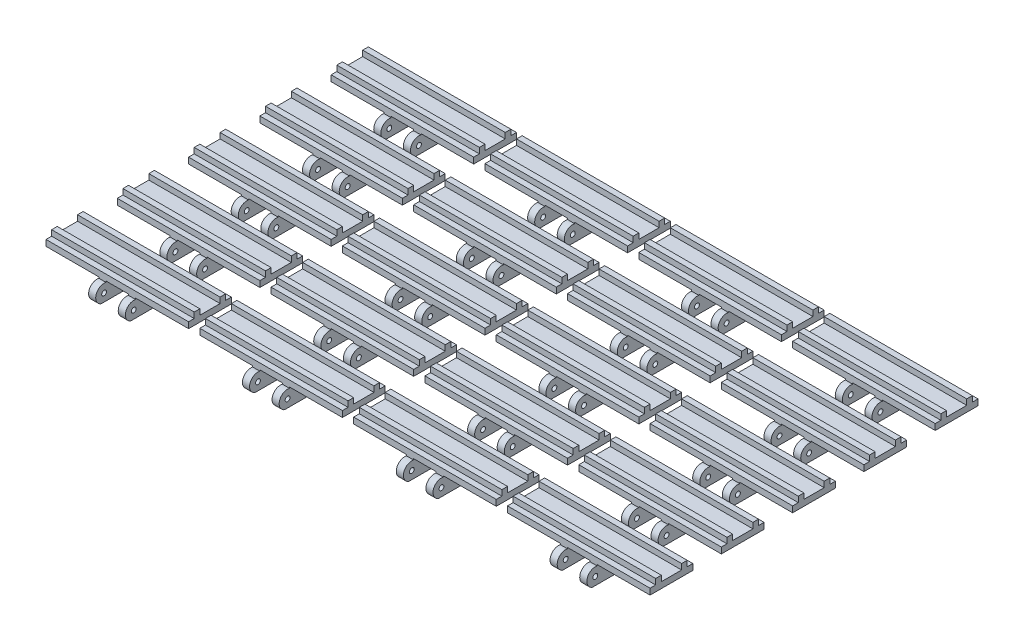
from build123d import *

# Parameters (mm, degrees)
SKETCH_1_W                = 38
SKETCH_1_H                = 11.4
EXTRUDE_1_DEPTH           = 1.6
SKETCH_1_4_W              = 4
SKETCH_1_4_H              = 14
EXTRUDE_2_DEPTH           = 5
SKETCH_2_W                = 0.1
SKETCH_2_H                = 1.3
SKETCH_2_W_2              = 10
SKETCH_2_W_3              = 2
CUT_EXTRUDE_1_DEPTH       = 21.856653615
CUT_EXTRUDE_START         = 7
CUT_EXTRUDE_2_DEPTH       = 2.1
CUT_EXTRUDE_START_2       = -4.9
CUT_EXTRUDE_3_DEPTH       = 2.1
CUT_EXTRUDE_6_DEPTH       = 21.856653615
CUT_EXTRUDE_6_DEPTH_BACK  = 21.856653615
EXTRUDE_START             = 5.1
SKETCH_4_6_R              = 2.25
EXTRUDE_3_DEPTH           = 1.9
EXTRUDE_START_2           = -7
SKETCH_4_7_R              = 2.25
EXTRUDE_4_DEPTH           = 1.9
CUT_EXTRUDE_7_DEPTH       = 22.386970332
CUT_EXTRUDE_7_DEPTH_BACK  = 22.386970332
SKETCH_3_R                = 0.65
SKETCH_3_R_2              = 0.55
CUT_EXTRUDE_START_3       = 3
CUT_EXTRUDE_8_DEPTH       = 2.1
CUT_EXTRUDE_START_4       = -5.1
SKETCH_5_2_R              = 2.5
SKETCH_5_2_W              = 2.5
SKETCH_5_2_H              = 2.5
CUT_EXTRUDE_9_DEPTH       = 5.1
CUT_EXTRUDE_10_DEPTH      = 22.386970332
CUT_EXTRUDE_10_DEPTH_BACK = 22.386970332
EXTRUDE_START_3           = 3
EXTRUDE_5_DEPTH           = 1.9
EXTRUDE_START_4           = -4.9
EXTRUDE_6_DEPTH           = 1.9
CUT_EXTRUDE_11_DEPTH      = 22.386970332
CUT_EXTRUDE_11_DEPTH_BACK = 22.386970332
SKETCH_3_3_R              = 0.65
SKETCH_3_3_R_2            = 0.55
CUT_EXTRUDE_12_DEPTH      = 22.386970332
CUT_EXTRUDE_12_DEPTH_BACK = 22.386970332
SKETCH_9_W                = 15.45
SKETCH_9_H                = 0.397025916
SKETCH_10_W               = 38
SKETCH_10_H               = 1.5
EXTRUDE_7_DEPTH           = 1.5
FILLET_1_R                = 1
SKETCH_11_W               = 4.7
SKETCH_11_H               = 4.602974084
CUT_EXTRUDE_13_DEPTH      = 17.397649411
CUT_EXTRUDE_START_5       = 4.9
SKETCH_11_2_W             = 4.7
SKETCH_11_2_H             = 4.602974084
CUT_EXTRUDE_14_DEPTH      = 17.397649411
CUT_EXTRUDE_START_6       = 5.1
SKETCH_11_4_W             = 4.7
SKETCH_11_4_H             = 4.602974084
CUT_EXTRUDE_15_DEPTH      = 10.2
PATTERN_LINEAR_1_COUNT    = 5
PATTERN_LINEAR_1_PITCH    = 19
PATTERN_LINEAR_2_COUNT    = 4
PATTERN_LINEAR_2_PITCH    = 41


# Read off the part's stored shape, not the designer's step: 切除-拉伸8, 凸台-拉伸5, 凸台-拉伸6
with BuildPart() as part:
    # 草图1 → 凸台-拉伸1 (new body)
    with BuildSketch(Plane(origin=(0, 0, 0), x_dir=(1, 0, 0), z_dir=(0, 1, 0))):
        Rectangle(SKETCH_1_W, SKETCH_1_H)
    extrude(amount=EXTRUDE_1_DEPTH)

    # 草图1<4> → 凸台-拉伸2 (add)
    with BuildSketch(Plane(origin=(0, 0, 0), x_dir=(1, 0, 0), z_dir=(0, 1, 0))):
        with Locations((-5, 0)):
            Rectangle(SKETCH_1_4_W, SKETCH_1_4_H)
        with Locations((5, 0)):
            Rectangle(SKETCH_1_4_W, SKETCH_1_4_H)
    extrude(amount=-EXTRUDE_2_DEPTH)

    # 草图2 → 切除-拉伸1 (cut, through all)
    with BuildSketch(Plane(origin=(0, 0, 0), x_dir=(1, 0, 0), z_dir=(0, 1, 0))):
        with Locations((-5.05, 6.35)):
            Rectangle(SKETCH_2_W, SKETCH_2_H)
        with Locations((0, 6.35)):
            Rectangle(SKETCH_2_W_2, SKETCH_2_H)
        with Locations((5.05, 6.35)):
            Rectangle(SKETCH_2_W, SKETCH_2_H)
        with Locations((-6, -6.35)):
            Rectangle(SKETCH_2_W_3, SKETCH_2_H)
        with Locations((-4.95, -6.35)):
            Rectangle(SKETCH_2_W, SKETCH_2_H)
        with Locations((4.95, -6.35)):
            Rectangle(SKETCH_2_W, SKETCH_2_H)
        with Locations((6, -6.35)):
            Rectangle(SKETCH_2_W_3, SKETCH_2_H)
    extrude(amount=-CUT_EXTRUDE_1_DEPTH, mode=Mode.SUBTRACT)

    # 草图4 → 切除-拉伸2 (cut)
    with BuildSketch(Plane(origin=(0, 0, 0), x_dir=(0, 0, -1), z_dir=(1, 0, 0)).offset(CUT_EXTRUDE_START)):
        with BuildLine():
            ThreePointArc((-3.7, -2.5), (-4.263508327, -0.91886117), (-5.7, -0.050510257))
            Line((-5.7, -0.050510257), (-5.7, -5))
            Line((-5.7, -5), (-3.7, -5))
            Line((-3.7, -5), (-3.7, -2.5))
        make_face()
    extrude(amount=-CUT_EXTRUDE_2_DEPTH, mode=Mode.SUBTRACT)

    # 草图4<3> → 切除-拉伸3 (cut)
    with BuildSketch(Plane(origin=(0, 0, 0), x_dir=(0, 0, -1), z_dir=(1, 0, 0)).offset(CUT_EXTRUDE_START_2)):
        with BuildLine():
            ThreePointArc((-3.7, -2.5), (-4.263508327, -0.91886117), (-5.7, -0.050510257))
            Line((-5.7, -0.050510257), (-5.7, -5))
            Line((-5.7, -5), (-3.7, -5))
            Line((-3.7, -5), (-3.7, -2.5))
        make_face()
    extrude(amount=-CUT_EXTRUDE_3_DEPTH, mode=Mode.SUBTRACT)

    # 草图4<5> → 切除-拉伸6 (cut, two sides: drawn at the far end of the back side and taken through both)
    with BuildSketch(Plane(origin=(0, 0, 0), x_dir=(0, 0, -1), z_dir=(1, 0, 0)).offset(-CUT_EXTRUDE_6_DEPTH_BACK)):
        with BuildLine():
            Line((8.45, 0), (5.7, 0))
            Line((5.7, 0), (5.7, -0.306258903))
            ThreePointArc((5.7, -0.306258903), (7.60312152, -0.74109409), (8.45, -2.5))
            Line((8.45, -2.5), (8.45, 0))
        make_face()
        with BuildLine():
            Line((8.45, -5), (8.45, -2.5))
            ThreePointArc((8.45, -2.5), (7.60312152, -4.25890591), (5.7, -4.693741097))
            Line((5.7, -4.693741097), (5.7, -5))
            Line((5.7, -5), (8.45, -5))
        make_face()
    extrude(amount=CUT_EXTRUDE_6_DEPTH + CUT_EXTRUDE_6_DEPTH_BACK, mode=Mode.SUBTRACT)

    # 草图4<6> → 凸台-拉伸3 (add)
    with BuildSketch(Plane(origin=(0, 0, 0), x_dir=(0, 0, -1), z_dir=(1, 0, 0)).offset(EXTRUDE_START)):
        with Locations((6.2, -2.5)):
            Circle(SKETCH_4_6_R)
    extrude(amount=EXTRUDE_3_DEPTH)

    # 草图4<7> → 凸台-拉伸4 (add)
    with BuildSketch(Plane(origin=(0, 0, 0), x_dir=(0, 0, -1), z_dir=(1, 0, 0)).offset(EXTRUDE_START_2)):
        with Locations((6.2, -2.5)):
            Circle(SKETCH_4_7_R)
    extrude(amount=EXTRUDE_4_DEPTH)

    # 草图3 → 切除-拉伸7 (cut, two sides: drawn at the far end of the back side and taken through both)
    with BuildSketch(Plane(origin=(0, 0, 0), x_dir=(0, 0, -1), z_dir=(1, 0, 0)).offset(-CUT_EXTRUDE_7_DEPTH_BACK)):
        with Locations(Location((-6.2, -2.5, 0), (0, 0, 180))):
            Circle(SKETCH_3_R)
        with Locations(Location((6.2, -2.5, 0), (0, 0, 204.619977329))):
            Circle(SKETCH_3_R_2)
    extrude(amount=CUT_EXTRUDE_7_DEPTH + CUT_EXTRUDE_7_DEPTH_BACK, mode=Mode.SUBTRACT)

    # 切除-拉伸8 outline → 切除-拉伸8 (cut)
    with BuildSketch(Plane(origin=(0, 0, 0), x_dir=(0, 0, -1), z_dir=(1, 0, 0)).offset(CUT_EXTRUDE_START_3)):
        with BuildLine():
            Line((3.7, -2.5), (3.7, -5))
            Line((3.7, -5), (5.7, -5))
            Line((5.7, -5), (5.7, -2.729128785))
            ThreePointArc((5.7, -2.729128785), (5.65, -2.5), (5.7, -2.270871215))
            Line((5.7, -2.270871215), (5.7, -0.050510257))
            ThreePointArc((5.7, -0.050510257), (4.263508327, -0.91886117), (3.7, -2.5))
        make_face()
    extrude(amount=CUT_EXTRUDE_8_DEPTH, mode=Mode.SUBTRACT)

    # 草图5<2> → 切除-拉伸9 (cut)
    with BuildSketch(Plane(origin=(0, 0, 0), x_dir=(0, 0, -1), z_dir=(1, 0, 0)).offset(CUT_EXTRUDE_START_4)):
        with Locations((6.2, -2.5)):
            Circle(SKETCH_5_2_R)
        with Locations((4.95, -3.75)):
            Rectangle(SKETCH_5_2_W, SKETCH_5_2_H)
    extrude(amount=CUT_EXTRUDE_9_DEPTH, mode=Mode.SUBTRACT)

    # 草图7 → 切除-拉伸10 (cut, two sides: drawn at the far end of the back side and taken through both)
    with BuildSketch(Plane(origin=(0, 0, 0), x_dir=(0, 0, -1), z_dir=(1, 0, 0)).offset(-CUT_EXTRUDE_10_DEPTH_BACK)):
        with BuildLine():
            Line((-5.7, -0.306258903), (-5.7, 0))
            Line((-5.7, 0), (-8.45, 0))
            Line((-8.45, 0), (-8.45, -2.5))
            ThreePointArc((-8.45, -2.5), (-7.60312152, -0.74109409), (-5.7, -0.306258903))
        make_face()
    extrude(amount=CUT_EXTRUDE_10_DEPTH + CUT_EXTRUDE_10_DEPTH_BACK, mode=Mode.SUBTRACT)

    # 凸台-拉伸5 outline → 凸台-拉伸5 (add)
    with BuildSketch(Plane(origin=(0, 0, 0), x_dir=(0, 0, -1), z_dir=(1, 0, 0)).offset(EXTRUDE_START_3)):
        with BuildLine():
            Line((-7, -4.602974084), (-7, -0.397025915))
            ThreePointArc((-7, -0.397025915), (-8.45, -2.5), (-7, -4.602974084))
        make_face()
        with BuildLine():
            ThreePointArc((-5.7, -2.084668807), (-6.85, -2.5), (-5.7, -2.915331193))
            Line((-5.7, -2.915331193), (-5.7, -2.084668807))
        make_face()
    extrude(amount=EXTRUDE_5_DEPTH)

    # 凸台-拉伸6 outline → 凸台-拉伸6 (add)
    with BuildSketch(Plane(origin=(0, 0, 0), x_dir=(0, 0, -1), z_dir=(1, 0, 0)).offset(EXTRUDE_START_4)):
        with BuildLine():
            Line((-7, -4.602974084), (-7, -0.397025915))
            ThreePointArc((-7, -0.397025915), (-8.45, -2.5), (-7, -4.602974084))
        make_face()
        with BuildLine():
            ThreePointArc((-5.7, -2.084668807), (-6.85, -2.5), (-5.7, -2.915331193))
            Line((-5.7, -2.915331193), (-5.7, -2.084668807))
        make_face()
    extrude(amount=EXTRUDE_6_DEPTH)

    # 草图3<3> → 切除-拉伸11 (cut, two sides: drawn at the far end of the back side and taken through both)
    with BuildSketch(Plane(origin=(0, 0, 0), x_dir=(0, 0, -1), z_dir=(1, 0, 0)).offset(-CUT_EXTRUDE_11_DEPTH_BACK)):
        with Locations(Location((-6.2, -2.5, 0), (0, 0, 180))):
            Circle(SKETCH_3_3_R)
        with Locations(Location((6.2, -2.5, 0), (0, 0, 180))):
            Circle(SKETCH_3_3_R_2)
    extrude(amount=CUT_EXTRUDE_11_DEPTH + CUT_EXTRUDE_11_DEPTH_BACK, mode=Mode.SUBTRACT)

    # 草图9 → 切除-拉伸12 (cut, two sides: drawn at the far end of the back side and taken through both)
    with BuildSketch(Plane(origin=(0, 0, 0), x_dir=(0, 0, -1), z_dir=(1, 0, 0)).offset(-CUT_EXTRUDE_12_DEPTH_BACK)):
        with Locations((0.725, -4.801487042)):
            Rectangle(SKETCH_9_W, SKETCH_9_H)
    extrude(amount=CUT_EXTRUDE_12_DEPTH + CUT_EXTRUDE_12_DEPTH_BACK, mode=Mode.SUBTRACT)

    # 草图10 → 凸台-拉伸7 (add)
    with BuildSketch(Plane(origin=(0, 1.6, 0), x_dir=(1, 0, 0), z_dir=(0, 1, 0))):
        with Locations((0, 3.45)):
            Rectangle(SKETCH_10_W, SKETCH_10_H)
        with Locations((0, -3.45)):
            Rectangle(SKETCH_10_W, SKETCH_10_H)
    extrude(amount=EXTRUDE_7_DEPTH)

    # 圆角1
    fillet_1_edges = [part.edges().sort_by_distance(p)[0] for p in [
        (5.95, -4.602974084, 3.7),
        (4.05, -4.602974084, -3.7),
        (-4.05, -4.602974084, -3.7),
        (-5.95, -4.602974084, 3.7),
    ]]
    fillet(fillet_1_edges, radius=FILLET_1_R)

    # 草图11 → 切除-拉伸13 (cut, through all)
    with BuildSketch(Plane(origin=(0, 0, 0), x_dir=(0, 0, -1), z_dir=(1, 0, 0)).offset(CUT_EXTRUDE_START_2)):
        with Locations((-3.35, -2.301487042)):
            Rectangle(SKETCH_11_W, SKETCH_11_H)
    extrude(amount=-CUT_EXTRUDE_13_DEPTH, mode=Mode.SUBTRACT)

    # 草图11<2> → 切除-拉伸14 (cut, through all)
    with BuildSketch(Plane(origin=(0, 0, 0), x_dir=(0, 0, -1), z_dir=(1, 0, 0)).offset(CUT_EXTRUDE_START_5)):
        with Locations((-3.35, -2.301487042)):
            Rectangle(SKETCH_11_2_W, SKETCH_11_2_H)
    extrude(amount=CUT_EXTRUDE_14_DEPTH, mode=Mode.SUBTRACT)

    # 草图11<4> → 切除-拉伸15 (cut)
    with BuildSketch(Plane(origin=(0, 0, 0), x_dir=(0, 0, -1), z_dir=(1, 0, 0)).offset(CUT_EXTRUDE_START_6)):
        with Locations((3.35, -2.301487042)):
            Rectangle(SKETCH_11_4_W, SKETCH_11_4_H)
    extrude(amount=-CUT_EXTRUDE_15_DEPTH, mode=Mode.SUBTRACT)


with BuildPart() as pattern_linear_1_1:
    # 阵列(线性)1: pattern copy
    add(part.part.moved(Location(Vector(0, 0, 1) * (1 * PATTERN_LINEAR_1_PITCH))))


with BuildPart() as pattern_linear_1_2:
    # 阵列(线性)1: pattern copy
    add(part.part.moved(Location(Vector(0, 0, 1) * (2 * PATTERN_LINEAR_1_PITCH))))


with BuildPart() as pattern_linear_1_3:
    # 阵列(线性)1: pattern copy
    add(part.part.moved(Location(Vector(0, 0, 1) * (3 * PATTERN_LINEAR_1_PITCH))))


with BuildPart() as pattern_linear_1_4:
    # 阵列(线性)1: pattern copy
    add(part.part.moved(Location(Vector(0, 0, 1) * (4 * PATTERN_LINEAR_1_PITCH))))


with BuildPart() as pattern_linear_2_1:
    # 阵列(线性)2: pattern copy
    add(pattern_linear_1_4.part.moved(Location(Vector(-1, 0, 0) * (1 * PATTERN_LINEAR_2_PITCH))))


with BuildPart() as pattern_linear_2_2:
    # 阵列(线性)2: pattern copy
    add(pattern_linear_1_4.part.moved(Location(Vector(-1, 0, 0) * (2 * PATTERN_LINEAR_2_PITCH))))


with BuildPart() as pattern_linear_2_3:
    # 阵列(线性)2: pattern copy
    add(pattern_linear_1_4.part.moved(Location(Vector(-1, 0, 0) * (3 * PATTERN_LINEAR_2_PITCH))))


with BuildPart() as pattern_linear_2_4:
    # 阵列(线性)2: pattern copy
    add(part.part.moved(Location(Vector(-1, 0, 0) * (1 * PATTERN_LINEAR_2_PITCH))))


with BuildPart() as pattern_linear_2_5:
    # 阵列(线性)2: pattern copy
    add(part.part.moved(Location(Vector(-1, 0, 0) * (2 * PATTERN_LINEAR_2_PITCH))))


with BuildPart() as pattern_linear_2_6:
    # 阵列(线性)2: pattern copy
    add(part.part.moved(Location(Vector(-1, 0, 0) * (3 * PATTERN_LINEAR_2_PITCH))))


with BuildPart() as pattern_linear_2_7:
    # 阵列(线性)2: pattern copy
    add(pattern_linear_1_1.part.moved(Location(Vector(-1, 0, 0) * (1 * PATTERN_LINEAR_2_PITCH))))


with BuildPart() as pattern_linear_2_8:
    # 阵列(线性)2: pattern copy
    add(pattern_linear_1_1.part.moved(Location(Vector(-1, 0, 0) * (2 * PATTERN_LINEAR_2_PITCH))))


with BuildPart() as pattern_linear_2_9:
    # 阵列(线性)2: pattern copy
    add(pattern_linear_1_1.part.moved(Location(Vector(-1, 0, 0) * (3 * PATTERN_LINEAR_2_PITCH))))


with BuildPart() as pattern_linear_2_10:
    # 阵列(线性)2: pattern copy
    add(pattern_linear_1_2.part.moved(Location(Vector(-1, 0, 0) * (1 * PATTERN_LINEAR_2_PITCH))))


with BuildPart() as pattern_linear_2_11:
    # 阵列(线性)2: pattern copy
    add(pattern_linear_1_2.part.moved(Location(Vector(-1, 0, 0) * (2 * PATTERN_LINEAR_2_PITCH))))


with BuildPart() as pattern_linear_2_12:
    # 阵列(线性)2: pattern copy
    add(pattern_linear_1_2.part.moved(Location(Vector(-1, 0, 0) * (3 * PATTERN_LINEAR_2_PITCH))))


with BuildPart() as pattern_linear_2_13:
    # 阵列(线性)2: pattern copy
    add(pattern_linear_1_3.part.moved(Location(Vector(-1, 0, 0) * (1 * PATTERN_LINEAR_2_PITCH))))


with BuildPart() as pattern_linear_2_14:
    # 阵列(线性)2: pattern copy
    add(pattern_linear_1_3.part.moved(Location(Vector(-1, 0, 0) * (2 * PATTERN_LINEAR_2_PITCH))))


with BuildPart() as pattern_linear_2_15:
    # 阵列(线性)2: pattern copy
    add(pattern_linear_1_3.part.moved(Location(Vector(-1, 0, 0) * (3 * PATTERN_LINEAR_2_PITCH))))


solid = Compound([part.part, pattern_linear_1_1.part, pattern_linear_1_2.part, pattern_linear_1_3.part, pattern_linear_1_4.part, pattern_linear_2_1.part, pattern_linear_2_2.part, pattern_linear_2_3.part, pattern_linear_2_4.part, pattern_linear_2_5.part, pattern_linear_2_6.part, pattern_linear_2_7.part, pattern_linear_2_8.part, pattern_linear_2_9.part, pattern_linear_2_10.part, pattern_linear_2_11.part, pattern_linear_2_12.part, pattern_linear_2_13.part, pattern_linear_2_14.part, pattern_linear_2_15.part])
